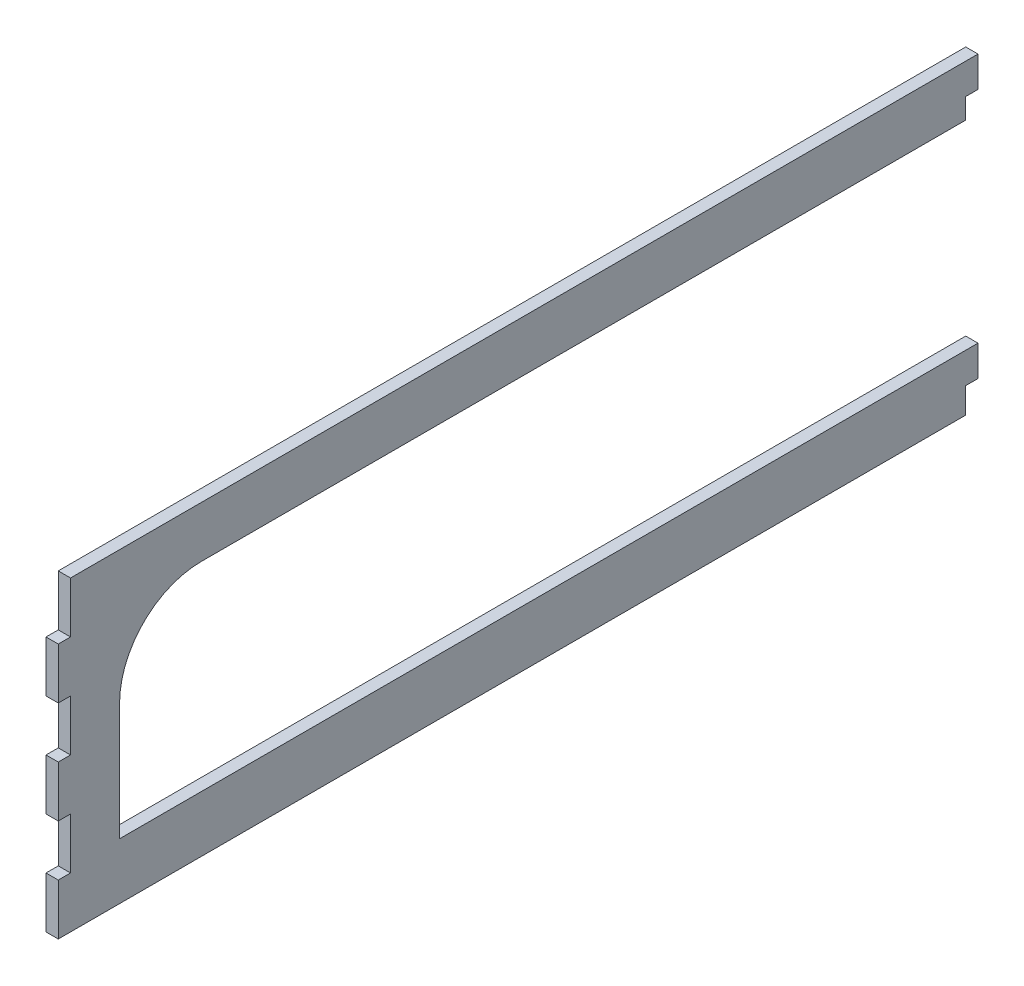
from build123d import *

# Parameters (mm, degrees)
BOSS_EXTRUDE1_DEPTH = 6
SKETCH2_W           = 6
SKETCH2_H           = 25
CUT_EXTRUDE1_DEPTH  = 6
LPATTERN1_COUNT     = 3
LPATTERN1_PITCH     = 50
FILLET1_R           = 40
SKETCH3_W           = 6
SKETCH3_H           = 10
SKETCH3_H_2         = 12.5
CUT_EXTRUDE2_DEPTH  = 475.379594839


with BuildPart() as part:
    # Sketch1 → Boss-Extrude1 (new body)
    with BuildSketch(Plane(origin=(0, 0, 0), x_dir=(0, 0, -1), z_dir=(1, 0, 0))):
        Polygon((450, 125), (450, 150), (0, 150), (0, 0), (450, 0), (450, 27.5), (30, 27.5), (30, 125), align=None)
    extrude(amount=BOSS_EXTRUDE1_DEPTH)

    # Sketch2 → Cut-Extrude1 (cut)
    with BuildSketch(Plane(origin=(6, 0, 0), x_dir=(0, 0, -1), z_dir=(1, 0, 0))):
        with Locations((3, 137.5)):
            Rectangle(SKETCH2_W, SKETCH2_H)
    cut_extrude1 = extrude(amount=-CUT_EXTRUDE1_DEPTH, mode=Mode.SUBTRACT)

    # LPattern1: Cut-Extrude1 ×3
    with Locations(*[(0, -i * LPATTERN1_PITCH, 0) for i in range(1, LPATTERN1_COUNT)]):
        add(cut_extrude1, mode=Mode.SUBTRACT)

    # Fillet1
    fillet1_edges = [part.edges().sort_by_distance(p)[0] for p in [
        (3, 125, -30),
    ]]
    fillet(fillet1_edges, radius=FILLET1_R)

    # Sketch3 → Cut-Extrude2 (cut, through all)
    with BuildSketch(Plane.ZY):
        with Locations((-447, 130)):
            Rectangle(SKETCH3_W, SKETCH3_H)
        with Locations((-447, 6.25)):
            Rectangle(SKETCH3_W, SKETCH3_H_2)
    extrude(amount=-CUT_EXTRUDE2_DEPTH, mode=Mode.SUBTRACT)


solid = part.part
